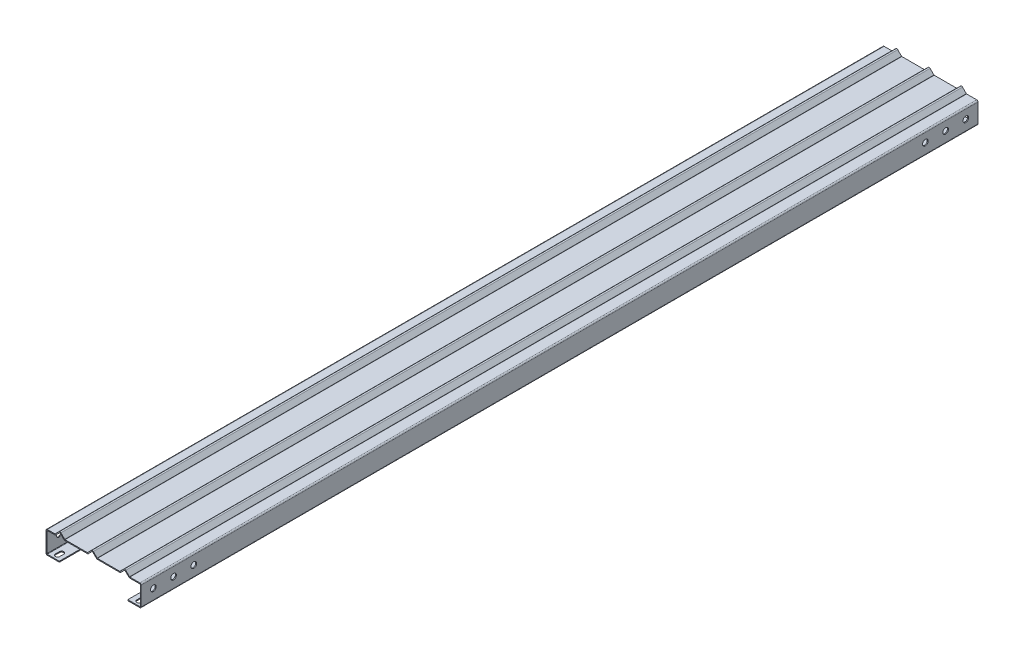
from build123d import *

# Parameters (mm, degrees)
SM_BASE_FLANGE_1_DEPTH = 2066
CUT_EXTRUDE_2_DEPTH    = 2.3
CUT_EXTRUDE_3_REACH    = 2082.296
CUT_EXTRUDE_4_REACH    = 2082.367
SKETCH_8_R             = 7


# Sheet-metal steps are written as plain solids
with BuildPart() as part:
    # Sketch 1 → 基体-法兰1 (new body)
    with BuildSketch(Plane.XY):
        with BuildLine():
            Line((33, 0), (3.3, 0))
            ThreePointArc((3.3, 0), (0.966547622, 0.966547622), (0, 3.3))
            Line((0, 3.3), (0, 52))
            ThreePointArc((0, 52), (0.966547622, 54.333452378), (3.3, 55.3))
            Line((3.3, 55.3), (22.085786438, 55.3))
            ThreePointArc((22.085786438, 55.3), (22.46846987, 55.376120467), (22.792893219, 55.592893219))
            Line((22.792893219, 55.592893219), (32.166547622, 64.966547622))
            ThreePointArc((32.166547622, 64.966547622), (34.5, 65.933095244), (36.833452378, 64.966547622))
            Line((36.833452378, 64.966547622), (46.207106781, 55.592893219))
            ThreePointArc((46.207106781, 55.592893219), (46.53153013, 55.376120467), (46.914213562, 55.3))
            Line((46.914213562, 55.3), (102.085786438, 55.3))
            ThreePointArc((102.085786438, 55.3), (102.46846987, 55.376120467), (102.792893219, 55.592893219))
            Line((102.792893219, 55.592893219), (112.166547622, 64.966547622))
            ThreePointArc((112.166547622, 64.966547622), (114.5, 65.933095244), (116.833452378, 64.966547622))
            Line((116.833452378, 64.966547622), (126.207106781, 55.592893219))
            ThreePointArc((126.207106781, 55.592893219), (126.53153013, 55.376120467), (126.914213562, 55.3))
            Line((126.914213562, 55.3), (182.085786438, 55.3))
            ThreePointArc((182.085786438, 55.3), (182.46846987, 55.376120467), (182.792893219, 55.592893219))
            Line((182.792893219, 55.592893219), (192.166547622, 64.966547622))
            ThreePointArc((192.166547622, 64.966547622), (194.5, 65.933095244), (196.833452378, 64.966547622))
            Line((196.833452378, 64.966547622), (206.207106781, 55.592893219))
            ThreePointArc((206.207106781, 55.592893219), (206.53153013, 55.376120467), (206.914213562, 55.3))
            Line((206.914213562, 55.3), (231.7, 55.3))
            ThreePointArc((231.7, 55.3), (234.033452378, 54.333452378), (235, 52))
            Line((235, 52), (235, 5.6))
            ThreePointArc((235, 5.6), (234.033452378, 3.266547622), (231.7, 2.3))
            Line((231.7, 2.3), (202, 2.3))
            Line((202, 2.3), (202, 4.6))
            Line((202, 4.6), (231.7, 4.6))
            ThreePointArc((231.7, 4.6), (232.407106781, 4.892893219), (232.7, 5.6))
            Line((232.7, 5.6), (232.7, 52))
            ThreePointArc((232.7, 52), (232.407106781, 52.707106781), (231.7, 53))
            Line((231.7, 53), (206.914213562, 53))
            ThreePointArc((206.914213562, 53), (205.651358236, 53.251197543), (204.580761184, 53.966547622))
            Line((204.580761184, 53.966547622), (195.207106781, 63.340202025))
            ThreePointArc((195.207106781, 63.340202025), (194.5, 63.633095244), (193.792893219, 63.340202025))
            Line((193.792893219, 63.340202025), (184.419238816, 53.966547622))
            ThreePointArc((184.419238816, 53.966547622), (183.348641764, 53.251197543), (182.085786438, 53))
            Line((182.085786438, 53), (126.914213562, 53))
            ThreePointArc((126.914213562, 53), (125.651358236, 53.251197543), (124.580761184, 53.966547622))
            Line((124.580761184, 53.966547622), (115.207106781, 63.340202025))
            ThreePointArc((115.207106781, 63.340202025), (114.5, 63.633095244), (113.792893219, 63.340202025))
            Line((113.792893219, 63.340202025), (104.419238816, 53.966547622))
            ThreePointArc((104.419238816, 53.966547622), (103.348641764, 53.251197543), (102.085786438, 53))
            Line((102.085786438, 53), (46.914213562, 53))
            ThreePointArc((46.914213562, 53), (45.651358236, 53.251197543), (44.580761184, 53.966547622))
            Line((44.580761184, 53.966547622), (35.207106781, 63.340202025))
            ThreePointArc((35.207106781, 63.340202025), (34.5, 63.633095244), (33.792893219, 63.340202025))
            Line((33.792893219, 63.340202025), (24.419238816, 53.966547622))
            ThreePointArc((24.419238816, 53.966547622), (23.348641764, 53.251197543), (22.085786438, 53))
            Line((22.085786438, 53), (3.3, 53))
            ThreePointArc((3.3, 53), (2.592893219, 52.707106781), (2.3, 52))
            Line((2.3, 52), (2.3, 3.3))
            ThreePointArc((2.3, 3.3), (2.592893219, 2.592893219), (3.3, 2.3))
            Line((3.3, 2.3), (33, 2.3))
            Line((33, 2.3), (33, 0))
        make_face()
    extrude(amount=SM_BASE_FLANGE_1_DEPTH)

    # 草图6 → 切除-拉伸2 (cut)
    with BuildSketch(Plane.XZ.offset(-2.3)):
        with BuildLine():
            Line((213.5, 2055.5), (213.5, 2045.5))
            ThreePointArc((213.5, 2045.5), (219, 2040), (224.5, 2045.5))
            Line((224.5, 2045.5), (224.5, 2055.5))
            ThreePointArc((224.5, 2055.5), (219, 2061), (213.5, 2055.5))
        make_face()
    cut_extrude_2 = extrude(amount=-CUT_EXTRUDE_2_DEPTH, mode=Mode.SUBTRACT)

    # 草图7 → 切除-拉伸3 (cut, up to next)
    with BuildSketch(Plane(origin=(0, 2.3, 0), x_dir=(-1, 0, 0), z_dir=(0, 1, 0)), mode=Mode.PRIVATE) as cut_extrude_3_sk1:
        with BuildLine():
            Line((-23.5, 2055.5), (-23.5, 2045.5))
            ThreePointArc((-23.5, 2045.5), (-18, 2040), (-12.5, 2045.5))
            Line((-12.5, 2045.5), (-12.5, 2055.5))
            ThreePointArc((-12.5, 2055.5), (-18, 2061), (-23.5, 2055.5))
        make_face()
    cut_extrude_3_tool1 = extrude(cut_extrude_3_sk1.sketch, amount=-CUT_EXTRUDE_3_REACH, mode=Mode.PRIVATE) & part.part
    cut_extrude_3 = cut_extrude_3_tool1.solids().sort_by_distance((18, 2.3, 2050.5))[0]
    add(cut_extrude_3, mode=Mode.SUBTRACT)

    # 镜向1: 切除-拉伸2, 切除-拉伸3 across plane
    add(cut_extrude_2.mirror(Plane(origin=(0, 0, 1033), x_dir=(1, 0, 0), z_dir=(0, 0, -1))), mode=Mode.SUBTRACT)
    add(cut_extrude_3.mirror(Plane(origin=(0, 0, 1033), x_dir=(1, 0, 0), z_dir=(0, 0, -1))), mode=Mode.SUBTRACT)

    # 切除-拉伸4: up to this face of the body (flat: up to its plane)
    cut_extrude_4_end = Plane(part.part.faces().sort_by_distance((0, 27.65, 1033))[0])
    # 草图8 → 切除-拉伸4 (cut, up to the picked face)
    with BuildSketch(Plane(origin=(235, 0, 0), x_dir=(0, 0, -1), z_dir=(1, 0, 0)), mode=Mode.PRIVATE) as cut_extrude_4_sk1:
        with Locations((-2036, 30.3)):
            Circle(SKETCH_8_R)
    cut_extrude_4_tool1 = split(extrude(cut_extrude_4_sk1.sketch, amount=-CUT_EXTRUDE_4_REACH, mode=Mode.PRIVATE), bisect_by=cut_extrude_4_end, keep=Keep.BOTH, mode=Mode.PRIVATE)
    # 草图8 → 切除-拉伸4 (cut, up to the picked face)
    with BuildSketch(Plane(origin=(235, 0, 0), x_dir=(0, 0, -1), z_dir=(1, 0, 0)), mode=Mode.PRIVATE) as cut_extrude_4_sk2:
        with Locations((-1986, 30.3)):
            Circle(SKETCH_8_R)
    cut_extrude_4_tool2 = split(extrude(cut_extrude_4_sk2.sketch, amount=-CUT_EXTRUDE_4_REACH, mode=Mode.PRIVATE), bisect_by=cut_extrude_4_end, keep=Keep.BOTH, mode=Mode.PRIVATE)
    # 草图8 → 切除-拉伸4 (cut, up to the picked face)
    with BuildSketch(Plane(origin=(235, 0, 0), x_dir=(0, 0, -1), z_dir=(1, 0, 0)), mode=Mode.PRIVATE) as cut_extrude_4_sk3:
        with Locations((-1936, 30.3)):
            Circle(SKETCH_8_R)
    cut_extrude_4_tool3 = split(extrude(cut_extrude_4_sk3.sketch, amount=-CUT_EXTRUDE_4_REACH, mode=Mode.PRIVATE), bisect_by=cut_extrude_4_end, keep=Keep.BOTH, mode=Mode.PRIVATE)
    cut_extrude_4_1 = cut_extrude_4_tool1.solids().sort_by(Axis((235, 30.3, 2036), (-1, 0, 0)))[0]
    add(cut_extrude_4_1, mode=Mode.SUBTRACT)
    cut_extrude_4_2 = cut_extrude_4_tool2.solids().sort_by(Axis((235, 30.3, 1986), (-1, 0, 0)))[0]
    add(cut_extrude_4_2, mode=Mode.SUBTRACT)
    cut_extrude_4_3 = cut_extrude_4_tool3.solids().sort_by(Axis((235, 30.3, 1936), (-1, 0, 0)))[0]
    add(cut_extrude_4_3, mode=Mode.SUBTRACT)
    cut_extrude_4 = cut_extrude_4_1 + cut_extrude_4_2 + cut_extrude_4_3  # 切除-拉伸4 as one shape, for the pattern or mirror that repeats it

    # 镜向2: 切除-拉伸4 across plane
    add(cut_extrude_4.mirror(Plane(origin=(0, 0, 1033), x_dir=(1, 0, 0), z_dir=(0, 0, -1))), mode=Mode.SUBTRACT)


solid = part.part
